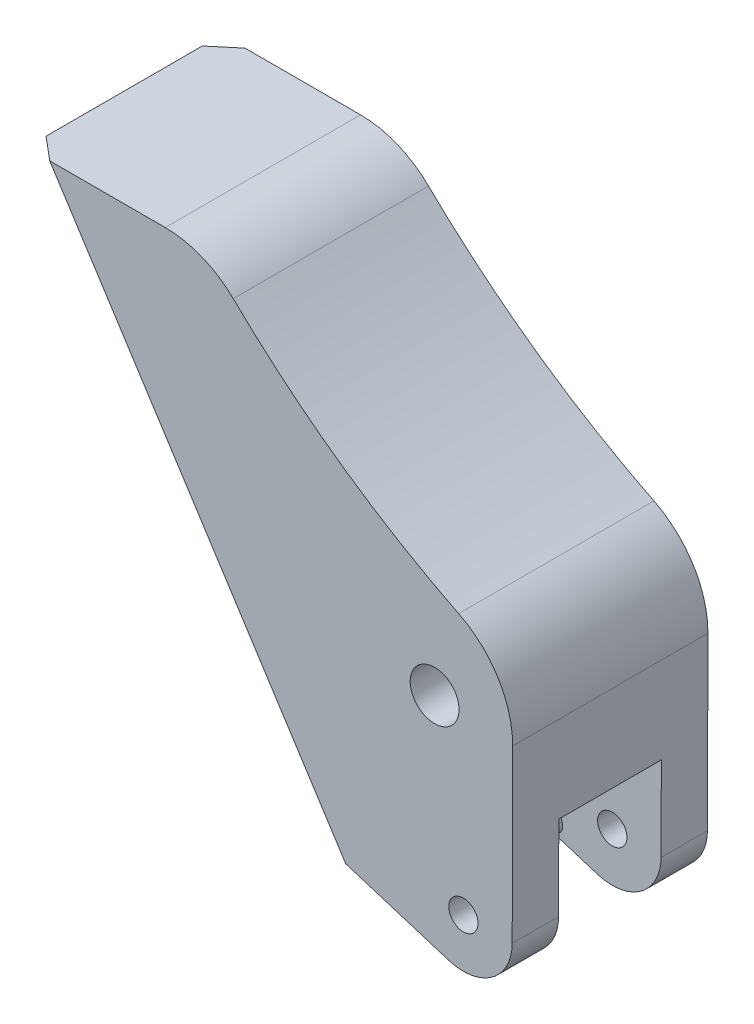
from build123d import *

# Parameters (mm, degrees)
EXTRUDE_1_DEPTH       = 20
FILLET_1_R            = 5
SKETCH_2_R            = 1.5000000000000024
CUT_EXTRUDE_1_DEPTH   = 24
CUT_EXTRUDE_START     = -5
SKETCH_3_R            = 7.5
CUT_EXTRUDE_2_DEPTH   = 10
CHAMFER_1_SIZE        = 2
FILLET_4_R            = 5
SKETCH_5_R            = 2.5000000000000018
CUT_EXTRUDE_3_DEPTH   = 25
EXTRUDE_START         = -11.5
SKETCH_6_R            = 2.5000000000000004
SKETCH_6_R_2          = 1.7499999999999998
EXTRUDE_2_DEPTH       = 3
CUT_EXTRUDE_4_DEPTH   = 34
FILLET_5_R            = 10
FILLET_6_R            = 10
CHAMFER_START         = 15.398006277
CHAMFER_2_OUTLINE_W   = 6.958890637
CHAMFER_2_OUTLINE_H   = 10.000000000000002
CHAMFER_2_DEPTH       = 3.601993723
CHAMFER_START_2       = 14
CHAMFER_2_2_OUTLINE_W = 6.958890637
CHAMFER_2_2_OUTLINE_H = 10.000000000000002
CHAMFER_2_2_DEPTH     = 1.398006277
SKETCH_9_R            = 10.000000000005517
CUT_EXTRUDE_5_DEPTH   = 10
EXTRUDE_4_DEPTH       = 10
FILLET_7_R            = 1
FILLET_8_R            = 10
CUT_EXTRUDE_START_2   = -0.25
CUT_EXTRUDE_6_DEPTH   = 0.25
CUT_EXTRUDE_7_DEPTH   = 0.25


with BuildPart() as part:
    # 草图1 → 凸台-拉伸1 (new body)
    with BuildSketch(Plane.XY):
        Polygon((0, 0), (-26.811555509164208, 22.497566339028918), (-49.8115555091642, 22.49756633902892), (-20.084941781424334, -23.776923785463527), (-0.08494178142433392, -29.999879747988462), align=None)
    extrude(amount=EXTRUDE_1_DEPTH)

    # 圆角1
    fillet_1_edges = [part.edges().sort_by_distance(p)[0] for p in [
        (-0.08494178142433392, -29.999879747988462, 10),
    ]]
    fillet(fillet_1_edges, radius=FILLET_1_R)

    # 草图2 → 切除-拉伸1 (cut)
    with BuildSketch(Plane.XY.offset(20)):
        with Locations((-5.0657473249540095, -23.213671166892293)):
            Circle(SKETCH_2_R)
    extrude(amount=-CUT_EXTRUDE_1_DEPTH, mode=Mode.SUBTRACT)

    # 草图3 → 切除-拉伸2 (cut)
    with BuildSketch(Plane.XY.offset(20).offset(CUT_EXTRUDE_START)):
        with Locations((-5.0657473249540095, -23.213671166892293)):
            Circle(SKETCH_3_R)
    extrude(amount=-CUT_EXTRUDE_2_DEPTH, mode=Mode.SUBTRACT)

    # 倒角1
    chamfer_1_edges = [part.edges().sort_by_distance(p)[0] for p in [
        (-34.94824864529427, -0.6396787232173011, 20),
        (-34.94824864529427, -0.6396787232173011, 0),
    ]]
    chamfer(chamfer_1_edges, length=CHAMFER_1_SIZE)

    # 圆角4
    fillet_4_edges = [part.edges().sort_by_distance(p)[0] for p in [
        (0, 0, 10),
    ]]
    fillet(fillet_4_edges, radius=FILLET_4_R)

    # 草图5 → 切除-拉伸3 (cut)
    with BuildSketch(Plane.XY.offset(20)):
        with Locations((-8.014794077059545, -5.213671166892294)):
            Circle(SKETCH_5_R)
    extrude(amount=-CUT_EXTRUDE_3_DEPTH, mode=Mode.SUBTRACT)

    # 草图6 → 凸台-拉伸2 (add)
    with BuildSketch(Plane(origin=(0, 0, 0), x_dir=(-1, 0, 0), z_dir=(0, 0, -1)).offset(EXTRUDE_START)):
        with Locations(Location((8.014794077059545, -5.213671166892294, 0), (0, 0, 180))):
            Circle(SKETCH_6_R)
        with Locations((8.014794077059545, -5.213671166892294)):
            Circle(SKETCH_6_R_2, mode=Mode.SUBTRACT)
    extrude(amount=EXTRUDE_2_DEPTH)

    # 草图7 → 切除-拉伸4 (cut)
    with BuildSketch(Plane.XY.offset(20)):
        with BuildLine():
            Line((-31.431124160284014, 22.497566339028918), (-26.811555509164208, 22.497566339028918))
            Line((-26.811555509164208, 22.497566339028918), (-1.7926678262045348, 1.5042269117916054))
            add(Edge.make_bspline(
                [(-1.7926678262045348, 1.5042269117916054), (-18.67112927693908, 9.044601568140122), (-31.431124160284014, 22.497566339028918)],
                knots=[0, 0, 0, 1, 1, 1], degree=2))
        make_face()
    extrude(amount=-CUT_EXTRUDE_4_DEPTH, mode=Mode.SUBTRACT)

    # 圆角5
    fillet_5_edges = [part.edges().sort_by_distance(p)[0] for p in [
        (-1.792667826204533, 1.504226911791605, 10),
    ]]
    fillet(fillet_5_edges, radius=FILLET_5_R)

    # 圆角6
    # the kernel refuses this fillet: 10 mm, written as the material it takes off along each edge
    with BuildSketch(Plane(origin=(-11.888995884089002, -26.327074304981263, 5), x_dir=(-0.9548468391902787, 0.29709849156186213, 0), z_dir=(0, 0, 1))) as fillet_6_piece_1:
        with BuildLine():
            CenterArc((11.180339887498954, -9.999999999999998), FILLET_6_R, 90.00000000000001, 73.39845040097977)
            ThreePointArc((1.597191412499857, -7.142857142857143), (1.7290806033645267, -3.3633658232300525), (0, 0))
            Line((0, 0), (11.180339887498953, -2e-17))
        make_face()
    extrude(amount=10, mode=Mode.SUBTRACT)

    # 倒角2: read off the stored shape, not the designer's step
    # 倒角2 outline → 倒角2 (cut)
    with BuildSketch(Plane(origin=(0, 0, 0), x_dir=(0.9972181140668777, 0.0745388018209292, 0), z_dir=(0.07453880182092919, -0.9972181140668778, 0)).offset(CHAMFER_START)):
        with Locations((-4.674246913499999, 10)):
            Rectangle(CHAMFER_2_OUTLINE_W, CHAMFER_2_OUTLINE_H)
    extrude(amount=CHAMFER_2_DEPTH, mode=Mode.SUBTRACT)

    # Chamfer 2 2 outline → Chamfer 2 2 (add)
    with BuildSketch(Plane(origin=(0, 0, 0), x_dir=(0.9972181140668777, 0.0745388018209292, 0), z_dir=(0.07453880182092919, -0.9972181140668778, 0)).offset(CHAMFER_START_2)):
        with Locations((-4.674246913499999, 10)):
            Rectangle(CHAMFER_2_2_OUTLINE_W, CHAMFER_2_2_OUTLINE_H)
    extrude(amount=CHAMFER_2_2_DEPTH)

    # 草图9 → 切除-拉伸5 (cut)
    with BuildSketch(Plane.XY.offset(4.999999999999999)):
        with Locations((-5.065747324960373, -23.21367116689012)):
            Circle(SKETCH_9_R)
    extrude(amount=CUT_EXTRUDE_5_DEPTH, mode=Mode.SUBTRACT)

    # 草图10 → 凸台-拉伸4 (add)
    with BuildSketch(Plane.XY.offset(4.999999999999999)):
        with BuildLine():
            Line((-20.306861182467813, -23.431468792638793), (-20.084941781424334, -23.776923785463527))
            Line((-20.084941781424334, -23.776923785463527), (-8.739068741608744, -27.30716719962209))
            ThreePointArc((-8.739068741608744, -27.30716719962209), (-10.29932188852527, -24.904735118255193), (-10.439836916118015, -22.04355960545204))
            Line((-10.439836916118015, -22.04355960545204), (-14.836819308888755, -21.086195600637897))
            ThreePointArc((-14.836819308888755, -21.086195600637897), (-14.95313679387356, -21.717165406749196), (-15.028752577744056, -22.354295618532444))
            ThreePointArc((-15.028752577744056, -22.354295618532444), (-17.59390852193624, -23.254981419998394), (-20.306861182467813, -23.431468792638793))
        make_face()
    extrude(amount=EXTRUDE_4_DEPTH)

    # 圆角7
    fillet_7_edges = [part.edges().sort_by_distance(p)[0] for p in [
        (-8.739068741608744, -27.30716719962209, 10),
    ]]
    fillet(fillet_7_edges, radius=FILLET_7_R)

    # 圆角8
    fillet_8_edges = [part.edges().sort_by_distance(p)[0] for p in [
        (-31.431124160284014, 22.497566339028918, 10),
    ]]
    fillet(fillet_8_edges, radius=FILLET_8_R)

    # 草图11 → 切除-拉伸6 (cut)
    with BuildSketch(Plane(origin=(0, 0, 15), x_dir=(-1, 0, 0), z_dir=(0, 0, -1)).offset(CUT_EXTRUDE_START_2)):
        with BuildLine():
            Line((6.551239782763319, -27.987905362843687), (11.44337405787706, -26.4657285550041))
            ThreePointArc((11.44337405787706, -26.4657285550041), (10.418424754087408, -26.19661722979815), (10.210809683029842, -25.157464708287105))
            ThreePointArc((10.210809683029842, -25.157464708287105), (10.550931066650136, -23.617105572837715), (10.439836916118015, -22.04355960545204))
            Line((10.439836916118015, -22.04355960545204), (14.836819308888755, -21.086195600637897))
            ThreePointArc((14.836819308888755, -21.086195600637897), (9.097555674937517, -14.06246788922412), (0.04124678677052372, -14.567608806379399))
            Line((0.04124678677052372, -14.567608806379399), (0.06576736695593181, -23.227828130463013))
            ThreePointArc((0.06576736695593181, -23.227828130463013), (2.1072866759334765, -27.24449125568279), (6.551239782763319, -27.987905362843687))
        make_face()
    extrude(amount=CUT_EXTRUDE_6_DEPTH, mode=Mode.SUBTRACT)

    # 草图12 → 切除-拉伸7 (cut)
    with BuildSketch(Plane.XY.offset(4.999999999999999)):
        with BuildLine():
            Line((-14.836819308888755, -21.086195600637897), (-10.439836916118015, -22.04355960545204))
            ThreePointArc((-10.439836916118015, -22.04355960545204), (-10.550931066650133, -23.617105572837712), (-10.21080968302984, -25.157464708287105))
            ThreePointArc((-10.21080968302984, -25.157464708287105), (-10.418424754087408, -26.19661722979815), (-11.44337405787706, -26.465728555004105))
            Line((-11.44337405787706, -26.465728555004105), (-6.551239782763319, -27.987905362843687))
            ThreePointArc((-6.551239782763319, -27.987905362843687), (-2.107286675933478, -27.24449125568279), (-0.06576736695593308, -23.227828130463013))
            Line((-0.06576736695593308, -23.227828130463013), (-0.04124678677052488, -14.567608806379397))
            ThreePointArc((-0.04124678677052488, -14.567608806379397), (-9.097555674937517, -14.062467889224122), (-14.836819308888755, -21.086195600637897))
        make_face()
    extrude(amount=-CUT_EXTRUDE_7_DEPTH, mode=Mode.SUBTRACT)


solid = part.part
